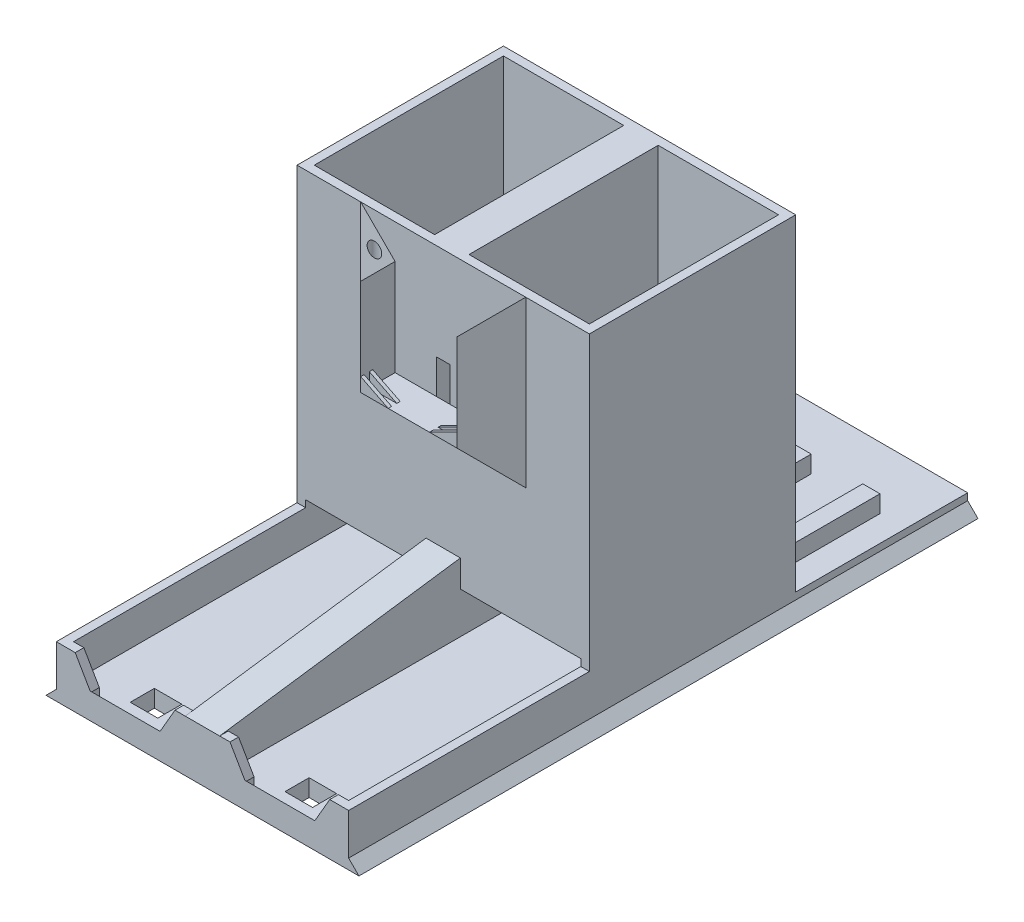
from build123d import *

# Parameters (mm, degrees)
SKETCH1_W                                 = 85
SKETCH1_H                                 = 60
BOSS_EXTRUDE1_DEPTH                       = 100
CUT_EXTRUDE1_START                        = 5
SKETCH2_W                                 = 35
SKETCH2_H                                 = 55
CUT_EXTRUDE1_DEPTH                        = 95
SKETCH3_W                                 = 85
SKETCH3_H                                 = 5
BOSS_EXTRUDE2_DEPTH                       = 70
BOSS_EXTRUDE3_DEPTH                       = 10
SKETCH5_W                                 = 20
SKETCH5_H                                 = 2.5
CUT_EXTRUDE2_DEPTH                        = 7.5
SKETCH6_W                                 = 35
SKETCH6_H                                 = 12
CUT_EXTRUDE4_DEPTH                        = 57.5
CUT_EXTRUDE6_REACH                        = 186.73
SKETCH7_R                                 = 4
SKETCH9_W                                 = 85
SKETCH9_H                                 = 50
BOSS_EXTRUDE4_DEPTH                       = 5
SKETCH13_W                                = 8
SKETCH13_H                                = 7
CUT_EXTRUDE8_BUTTON_HOLES_DEPTH           = 169.374582405
SKETCH14_W                                = 28
SKETCH14_H                                = 28
BOSS_EXTRUDE5_OLED_MOUNT_DEPTH            = 10
BOSS_EXTRUDE6_OLED_MOUNT_DEPTH            = 1
BOSS_EXTRUDE7_START                       = -2.5
BOSS_EXTRUDE7_OLED_MOUNT_DEPTH            = 1
CHAMFER2_OLED_MOUNT_SIZE                  = 10
CUT_EXTRUDE7_START                        = -40.5
CUT_EXTRUDE7_OLED_CABLE_HOLE_DEPTH        = 4
CUT_EXTRUDE7_ROOF_CUTOUT_DEPTH            = 172.245437895
SKETCH18_W                                = 4
SKETCH18_H                                = 8
CUT_EXTRUDE9_OLED_CABLE_DEPTH             = 153.213665615
CHAMFER6_OLED_CABLE_HOLE_SIZE             = 2.5
CHAMFER6_OLED_CABLE_HOLE_SIZE2            = 4.330127019
SKETCH45_R                                = 1.5
CUT_EXTRUDE7_ROOF_HOLES_DEPTH             = 15
SKETCH20_W                                = 10
SKETCH20_H                                = 10
CUT_EXTRUDE10_SOLENOID_WIRE_HOLE_DEPTH    = 169.374582405
SKETCH21_W                                = 5
SKETCH21_H                                = 32
BOSS_EXTRUDE9_SOLENOID_SIDE_SUPPORT_DEPTH = 5
CHAMFER3_THUMB_SIZE                       = 2.5
CHAMFER5_THUMB_SIZE                       = 4.5
CHAMFER5_THUMB_SIZE2                      = 7.794228634
CHAMFER5_THUMB_PART_2_SIZE                = 4.5
CHAMFER5_THUMB_PART_2_SIZE2               = 7.794228634
CHAMFER5_THUMB_PART_3_SIZE                = 4.5
CHAMFER5_THUMB_PART_3_SIZE2               = 7.794228634
BOSS_EXTRUDE5_GUIDE_DEPTH                 = 180
SKETCH42_W                                = 10
SKETCH42_H                                = 70
BOSS_EXTRUDE8_DEPTH                       = 10
CHAMFER5_SIZE                             = 10
CHAMFER5_SIZE_2                           = 71.153697224


# Some blends are built 0.0001 mm under size
with BuildPart() as part:
    # Sketch1 → Boss-Extrude1 (new body)
    with BuildSketch(Plane(origin=(0, 0, 0), x_dir=(1, 0, 0), z_dir=(0, 1, 0))):
        with Locations((42.5, 30)):
            Rectangle(SKETCH1_W, SKETCH1_H)
    extrude(amount=BOSS_EXTRUDE1_DEPTH)

    # Sketch2 → Cut-Extrude1 (cut)
    with BuildSketch(Plane(origin=(0, 0, 0), x_dir=(1, 0, 0), z_dir=(0, 1, 0)).offset(CUT_EXTRUDE1_START)):
        with Locations((20, 30)):
            Rectangle(SKETCH2_W, SKETCH2_H)
        with Locations((65, 30)):
            Rectangle(SKETCH2_W, SKETCH2_H)
    extrude(amount=CUT_EXTRUDE1_DEPTH, mode=Mode.SUBTRACT)

    # Sketch3 → Boss-Extrude2 (add)
    with BuildSketch(Plane.XY):
        with Locations((42.5, 2.5)):
            Rectangle(SKETCH3_W, SKETCH3_H)
    extrude(amount=BOSS_EXTRUDE2_DEPTH)

    # Sketch4 → Boss-Extrude3 (add)
    with BuildSketch(Plane(origin=(0, 5, 0), x_dir=(1, 0, 0), z_dir=(0, 1, 0))):
        Polygon((85, 0), (82.5, 0), (82.5, -67.5), (47.5, -67.5), (47.5, 0), (37.5, 0), (37.5, -67.5), (2.5, -67.5), (2.5, 0), (0, 0), (0, -70), (85, -70), align=None)
    extrude(amount=BOSS_EXTRUDE3_DEPTH)

    # Sketch5 → Cut-Extrude2 (cut)
    with BuildSketch(Plane(origin=(0, 15, 0), x_dir=(1, 0, 0), z_dir=(0, 1, 0))):
        with Locations((20, -68.75)):
            Rectangle(SKETCH5_W, SKETCH5_H)
        with Locations((65, -68.75)):
            Rectangle(SKETCH5_W, SKETCH5_H)
    extrude(amount=-CUT_EXTRUDE2_DEPTH, mode=Mode.SUBTRACT)

    # Sketch6 → Cut-Extrude4 (cut)
    with BuildSketch(Plane.XY):
        with Locations((20, 11)):
            Rectangle(SKETCH6_W, SKETCH6_H)
        with Locations((65, 11)):
            Rectangle(SKETCH6_W, SKETCH6_H)
    extrude(amount=-CUT_EXTRUDE4_DEPTH, mode=Mode.SUBTRACT)

    # Sketch7 → Cut-Extrude6 (cut, up to next)
    with BuildSketch(Plane(origin=(0, 0, -60), x_dir=(-1, 0, 0), z_dir=(0, 0, -1)), mode=Mode.PRIVATE) as cut_extrude6_sk1:
        with Locations((-20, 11.5)):
            Circle(SKETCH7_R)
    cut_extrude6_tool1 = extrude(cut_extrude6_sk1.sketch, amount=-CUT_EXTRUDE6_REACH, mode=Mode.PRIVATE) & part.part
    # Sketch7 → Cut-Extrude6 (cut, up to next)
    with BuildSketch(Plane(origin=(0, 0, -60), x_dir=(-1, 0, 0), z_dir=(0, 0, -1)), mode=Mode.PRIVATE) as cut_extrude6_sk2:
        with Locations((-65, 11.5)):
            Circle(SKETCH7_R)
    cut_extrude6_tool2 = extrude(cut_extrude6_sk2.sketch, amount=-CUT_EXTRUDE6_REACH, mode=Mode.PRIVATE) & part.part
    add(cut_extrude6_tool1.solids().sort_by_distance((20, 11.5, -60))[0], mode=Mode.SUBTRACT)
    add(cut_extrude6_tool2.solids().sort_by_distance((65, 11.5, -60))[0], mode=Mode.SUBTRACT)

    # Sketch9 → Boss-Extrude4 (add)
    with BuildSketch(Plane(origin=(0, 0, 0), x_dir=(1, 0, 0), z_dir=(0, 1, 0))):
        with Locations((42.5, 85)):
            Rectangle(SKETCH9_W, SKETCH9_H)
    extrude(amount=BOSS_EXTRUDE4_DEPTH)

    # Sketch13 → Cut-Extrude8 (Button Holes) (cut, through all)
    with BuildSketch(Plane(origin=(0, 5, 0), x_dir=(1, 0, 0), z_dir=(0, 1, 0))):
        with Locations((20, -61)):
            Rectangle(SKETCH13_W, SKETCH13_H)
        with Locations((65, -61)):
            Rectangle(SKETCH13_W, SKETCH13_H)
    extrude(amount=-CUT_EXTRUDE8_BUTTON_HOLES_DEPTH, mode=Mode.SUBTRACT)

    # Sketch14 → Boss-Extrude5 (OLED Mount) (add)
    with BuildSketch(Plane.XY):
        Polygon((18.5, 93.172660782), (18.5, 52), (66.5, 52), (66.5, 93.172660782), (66.5, 100), (18.5, 100), align=None)
        with Locations((42.5, 76)):
            Rectangle(SKETCH14_W, SKETCH14_H, mode=Mode.SUBTRACT)
    extrude(amount=BOSS_EXTRUDE5_OLED_MOUNT_DEPTH)

    # Sketch40 → Boss-Extrude6 (OLED Mount) (add)
    with BuildSketch(Plane.XY.offset(10)):
        Polygon((28.5, 62), (36.5, 62), (28.5, 66), align=None)
        Polygon((56.5, 62), (48.5, 62), (56.5, 66), align=None)
    extrude(amount=-BOSS_EXTRUDE6_OLED_MOUNT_DEPTH)

    # Sketch40<2> → Boss-Extrude7 (OLED Mount) (add)
    with BuildSketch(Plane.XY.offset(10).offset(BOSS_EXTRUDE7_START)):
        Polygon((28.5, 62), (36.5, 62), (28.5, 66), align=None)
        Polygon((56.5, 62), (48.5, 62), (56.5, 66), align=None)
    extrude(amount=-BOSS_EXTRUDE7_OLED_MOUNT_DEPTH)

    # Chamfer2 (OLED Mount)
    chamfer2_oled_mount_edges = [part.edges().sort_by_distance(p)[0] for p in [
        (42.5, 52, 10),
        (66.5, 76, 10),
        (42.5, 100, 10),
        (18.5, 76, 10),
    ]]
    chamfer(chamfer2_oled_mount_edges, length=CHAMFER2_OLED_MOUNT_SIZE - 0.0001)  # a hair under: the kernel refuses the full size

    # Sketch44 → Cut-Extrude7 (OLED Cable Hole) (cut)
    with BuildSketch(Plane(origin=(85, 0, 0), x_dir=(0, 0, -1), z_dir=(1, 0, 0)).offset(CUT_EXTRUDE7_START)):
        Polygon((0, 62), (0, 72), (10.5, 62), align=None)
    extrude(amount=-CUT_EXTRUDE7_OLED_CABLE_HOLE_DEPTH, mode=Mode.SUBTRACT)

    # Sketch41 → Cut-Extrude7 (Roof Cutout) (cut, through all)
    with BuildSketch(Plane.XY):
        Polygon((18.5, 100), (28.5, 90), (56.5, 90), (66.5, 100), align=None)
    extrude(amount=CUT_EXTRUDE7_ROOF_CUTOUT_DEPTH, mode=Mode.SUBTRACT)

    # Sketch18 → Cut-Extrude9 (OLED Cable) (cut, through all)
    with BuildSketch(Plane(origin=(0, 62, 0), x_dir=(1, 0, 0), z_dir=(0, 1, 0))):
        with Locations((42.5, 6.5)):
            Rectangle(SKETCH18_W, SKETCH18_H)
    extrude(amount=-CUT_EXTRUDE9_OLED_CABLE_DEPTH, mode=Mode.SUBTRACT)

    # Chamfer6 (OLED Cable Hole)
    chamfer6_oled_cable_hole_edges = [part.edges().sort_by_distance(p)[0] for p in [
        (42.5, 62, -2.5),
    ]]
    chamfer6_oled_cable_hole_side = [part.faces().sort_by_distance(p)[0] for p in [
        (42.5, 62, 4.354651163),
    ]]
    chamfer(chamfer6_oled_cable_hole_edges, length=CHAMFER6_OLED_CABLE_HOLE_SIZE, length2=CHAMFER6_OLED_CABLE_HOLE_SIZE2, reference=chamfer6_oled_cable_hole_side[0])

    # Sketch45 → Cut-Extrude7 (Roof Holes) (cut)
    with BuildSketch(Plane(origin=(0, 100, 0), x_dir=(1, 0, 0), z_dir=(0, 1, 0))):
        with Locations(Location((25.5, -3, 0), (0, 0, 270))):
            Circle(SKETCH45_R)
        with Locations((59.5, -3)):
            Circle(SKETCH45_R)
    extrude(amount=-CUT_EXTRUDE7_ROOF_HOLES_DEPTH, mode=Mode.SUBTRACT)

    # Sketch20 → Cut-Extrude10 (Solenoid Wire Hole) (cut, through all)
    with BuildSketch(Plane(origin=(0, 5, 0), x_dir=(1, 0, 0), z_dir=(0, 1, 0))):
        with Locations((65, 65)):
            Rectangle(SKETCH20_W, SKETCH20_H)
        with Locations((20, 65)):
            Rectangle(SKETCH20_W, SKETCH20_H)
    extrude(amount=-CUT_EXTRUDE10_SOLENOID_WIRE_HOLE_DEPTH, mode=Mode.SUBTRACT)

    # Sketch21 → Boss-Extrude9 (Solenoid Side Support) (add)
    with BuildSketch(Plane(origin=(0, 5, 0), x_dir=(1, 0, 0), z_dir=(0, 1, 0))):
        with Locations((75, 76)):
            Rectangle(SKETCH21_W, SKETCH21_H)
        with Locations((55, 76)):
            Rectangle(SKETCH21_W, SKETCH21_H)
        with Locations((30, 76)):
            Rectangle(SKETCH21_W, SKETCH21_H)
        with Locations((10, 76)):
            Rectangle(SKETCH21_W, SKETCH21_H)
    extrude(amount=BOSS_EXTRUDE9_SOLENOID_SIDE_SUPPORT_DEPTH)

    # Chamfer3 (Thumb)
    chamfer3_thumb_edges = [part.edges().sort_by_distance(p)[0] for p in [
        (20, 7.5, 67.5),
        (65, 7.5, 67.5),
    ]]
    chamfer(chamfer3_thumb_edges, length=CHAMFER3_THUMB_SIZE - 0.0001)  # a hair under: the kernel refuses the full size

    # Chamfer5 (Thumb)
    chamfer5_thumb_edges = [part.edges().sort_by_distance(p)[0] for p in [
        (75, 15, 68.75),
    ]]
    chamfer5_thumb_side = [part.faces().sort_by_distance(p)[0] for p in [
        (83.266129032, 15, 38.266129032),
    ]]
    chamfer(chamfer5_thumb_edges, length=CHAMFER5_THUMB_SIZE, length2=CHAMFER5_THUMB_SIZE2, reference=chamfer5_thumb_side[0])

    # Chamfer5 (Thumb) part 2
    chamfer5_thumb_part_2_edges = [part.edges().sort_by_distance(p)[0] for p in [
        (55, 15, 68.75),
        (30, 15, 68.75),
    ]]
    chamfer5_thumb_part_2_side = [part.faces().sort_by_distance(p)[0] for p in [
        (42.5, 15, 36.716101695),
    ]]
    chamfer(chamfer5_thumb_part_2_edges, length=CHAMFER5_THUMB_PART_2_SIZE, length2=CHAMFER5_THUMB_PART_2_SIZE2, reference=chamfer5_thumb_part_2_side[0])

    # Chamfer5 (Thumb) part 3
    chamfer5_thumb_part_3_edges = [part.edges().sort_by_distance(p)[0] for p in [
        (10, 15, 68.75),
    ]]
    chamfer5_thumb_part_3_side = [part.faces().sort_by_distance(p)[0] for p in [
        (1.733870968, 15, 38.266129032),
    ]]
    chamfer(chamfer5_thumb_part_3_edges, length=CHAMFER5_THUMB_PART_3_SIZE, length2=CHAMFER5_THUMB_PART_3_SIZE2, reference=chamfer5_thumb_part_3_side[0])

    # Sketch37 → Boss-Extrude5 (Guide) (add, through all)
    with BuildSketch(Plane.XY.offset(70)):
        Polygon((85, 0), (88, 0), (85, 3), align=None)
        Polygon((0, 0), (-3, 0), (0, 3), align=None)
    extrude(amount=-BOSS_EXTRUDE5_GUIDE_DEPTH)

    # Sketch42 → Boss-Extrude8 (add)
    with BuildSketch(Plane(origin=(0, 15, 0), x_dir=(1, 0, 0), z_dir=(0, 1, 0))):
        with Locations((42.5, -35)):
            Rectangle(SKETCH42_W, SKETCH42_H)
    extrude(amount=BOSS_EXTRUDE8_DEPTH)

    # Chamfer5
    # the kernel refuses this chamfer: 71.153697224, 10 mm, written as the material it takes off along each edge
    with BuildSketch(Plane(origin=(232.433017826, 25, 70), x_dir=(0, -0.965159882585439, 0.2616608511941778), z_dir=(-1, 0, 0))) as chamfer5_piece_1_section:
        Polygon((CHAMFER5_SIZE * 0.965159882585, -CHAMFER5_SIZE * 0.261660851194), (-CHAMFER5_SIZE_2 * 0.261660851194, -CHAMFER5_SIZE_2 * 0.965159882583), (0, 0), align=None)
    chamfer5_piece_1 = extrude(amount=379.866035651, mode=Mode.PRIVATE)
    chamfer5_piece_1 = split(chamfer5_piece_1, bisect_by=Plane(origin=(42.5, 22.433038023, 0), z_dir=(0, 0, 1)), keep=Keep.TOP, mode=Mode.PRIVATE)
    add(chamfer5_piece_1, mode=Mode.SUBTRACT)


solid = part.part
